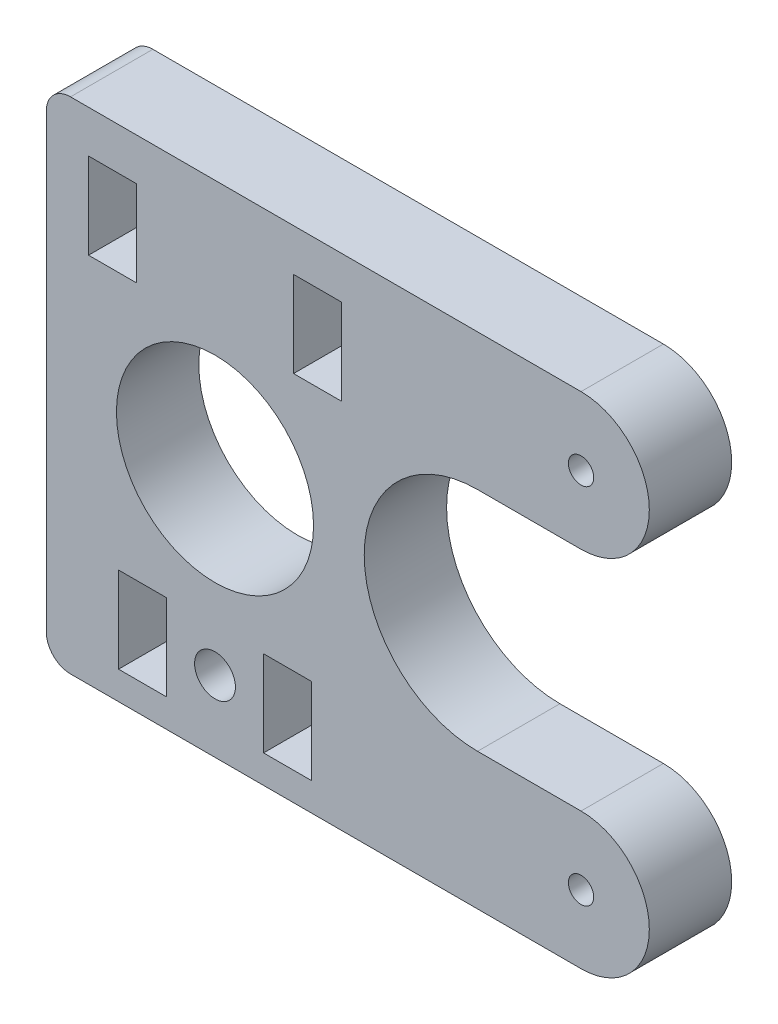
from build123d import *

# Parameters (mm, degrees)
SKETCH1_R           = 0.9
SKETCH1_R_2         = 1.45
SKETCH1_R_3         = 7
SKETCH1_W           = 3.400011
SKETCH1_H           = 6.1
SKETCH1_W_2         = 3.4
BOSS_EXTRUDE2_DEPTH = 5.85


with BuildPart() as part:
    # Sketch1 → Boss-Extrude2 (new body)
    with BuildSketch(Plane.XY):
        with BuildLine():
            Line((669.21684417, 348.51545661), (648.4638119, 348.51545661))
            ThreePointArc((648.4638119, 348.51545661), (647.249496344, 348.012470637), (646.746510371, 346.798155081))
            Line((646.746510371, 346.798155081), (646.746510371, 314.732758138))
            ThreePointArc((646.746510371, 314.732758138), (647.249496344, 313.518442582), (648.4638119, 313.01545661))
            Line((648.4638119, 313.01545661), (669.21684417, 313.01545661))
            Line((669.21684417, 313.01545661), (684.726521371, 313.01545661))
            ThreePointArc((684.726521371, 313.01545661), (689.576521371, 317.86545661), (684.726521371, 322.71545661))
            Line((684.726521371, 322.71545661), (677.376521371, 322.71545661))
            ThreePointArc((677.376521371, 322.71545661), (669.326521371, 330.76545661), (677.376521371, 338.81545661))
            Line((677.376521371, 338.81545661), (684.726521371, 338.81545661))
            ThreePointArc((684.726521371, 338.81545661), (689.576521371, 343.66545661), (684.726521371, 348.51545661))
            Line((684.726521371, 348.51545661), (669.21684417, 348.51545661))
        make_face()
        with Locations((684.726521371, 343.66545661)):
            Circle(SKETCH1_R, mode=Mode.SUBTRACT)
        with Locations((684.726521371, 317.86545661)):
            Circle(SKETCH1_R, mode=Mode.SUBTRACT)
        with Locations((658.726521371, 318.06545661)):
            Circle(SKETCH1_R_2, mode=Mode.SUBTRACT)
        with Locations((658.726521371, 330.76545661)):
            Circle(SKETCH1_R_3, mode=Mode.SUBTRACT)
        with Locations((651.446515871, 342.46545661)):
            Rectangle(SKETCH1_W, SKETCH1_H, mode=Mode.SUBTRACT)
        with Locations((653.576521371, 318.06545661)):
            Rectangle(SKETCH1_W_2, SKETCH1_H, mode=Mode.SUBTRACT)
        with Locations((666.006526871, 342.46545661)):
            Rectangle(SKETCH1_W, SKETCH1_H, mode=Mode.SUBTRACT)
        with Locations((663.876521371, 318.06545661)):
            Rectangle(SKETCH1_W_2, SKETCH1_H, mode=Mode.SUBTRACT)
    extrude(amount=BOSS_EXTRUDE2_DEPTH)


solid = part.part
